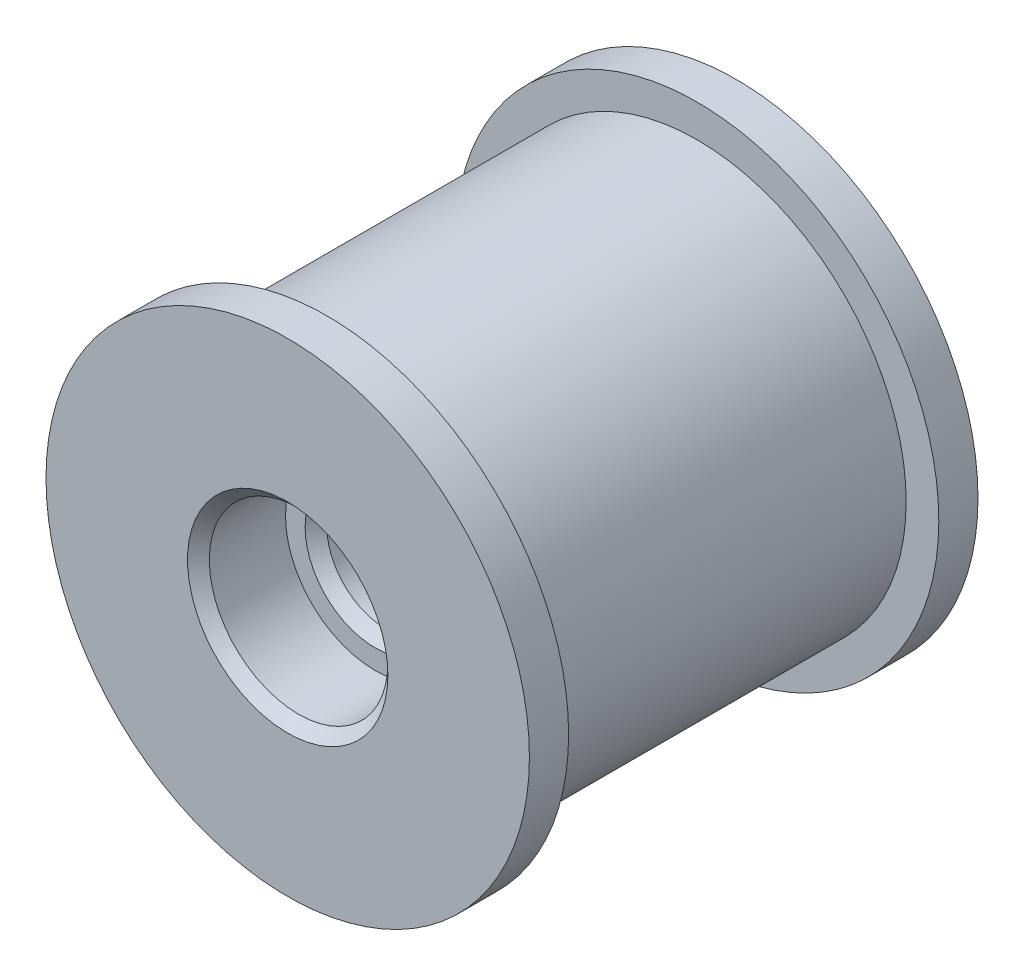
from build123d import *

# Parameters (mm, degrees)
AUFSATZ_LINEAR_AUSTRAGEN1_DEPTH      = 10.3
AUFSATZ_LINEAR_AUSTRAGEN1_DEPTH_BACK = 10.3
SKIZZE1_R                            = 9.6
SKIZZE2_R                            = 11.1
AUFSATZ_LINEAR_AUSTRAGEN2_DEPTH      = 1.8
AUFSATZ_LINEAR_START                 = -1.8
SKIZZE3_R                            = 11.1
AUFSATZ_LINEAR_AUSTRAGEN3_DEPTH      = 1.8
FASE1_SIZE                           = 0.5


with BuildPart() as part:
    # Skizze1 → Aufsatz-Linear austragen1 (new, two sides: drawn at the far end of the back side and taken through both)
    with BuildSketch(Plane.XY.offset(-AUFSATZ_LINEAR_AUSTRAGEN1_DEPTH_BACK)):
        Circle(SKIZZE1_R)
    extrude(amount=AUFSATZ_LINEAR_AUSTRAGEN1_DEPTH + AUFSATZ_LINEAR_AUSTRAGEN1_DEPTH_BACK)

    # Skizze2 → Aufsatz-Linear austragen2 (add)
    with BuildSketch(Plane.XY.offset(10.3)):
        Circle(SKIZZE2_R)
    extrude(amount=-AUFSATZ_LINEAR_AUSTRAGEN2_DEPTH)

    # Skizze3 → Aufsatz-Linear austragen3 (add)
    with BuildSketch(Plane(origin=(0, 0, -10.3), x_dir=(-1, 0, 0), z_dir=(0, 0, -1)).offset(AUFSATZ_LINEAR_START)):
        Circle(SKIZZE3_R)
    extrude(amount=AUFSATZ_LINEAR_AUSTRAGEN3_DEPTH)

    # Skizze8 → Schnitt-Rotation1 (revolve, cut)
    with BuildSketch(Plane(origin=(0, 0, 0), x_dir=(0, 0, -1), z_dir=(1, 0, 0))):
        Polygon((10.3, 0), (10.3, 8), (8.5, 8), (-3.7, 4), (-3.7, 2.7), (-6.3, 2.7), (-6.3, 4.1), (-10.3, 4.1), (-10.3, 0), align=None)
    revolve(axis=Axis((0, 0, -9.8), (0, 0, 1)), mode=Mode.SUBTRACT)

    # Fase1
    fase1_edges = [part.edges().sort_by_distance(p)[0] for p in [
        (0, -2.7, 6.3),
        (0, -2.7, 3.7),
        (0, -4.1, 10.3),
    ]]
    chamfer(fase1_edges, length=FASE1_SIZE)


solid = part.part
